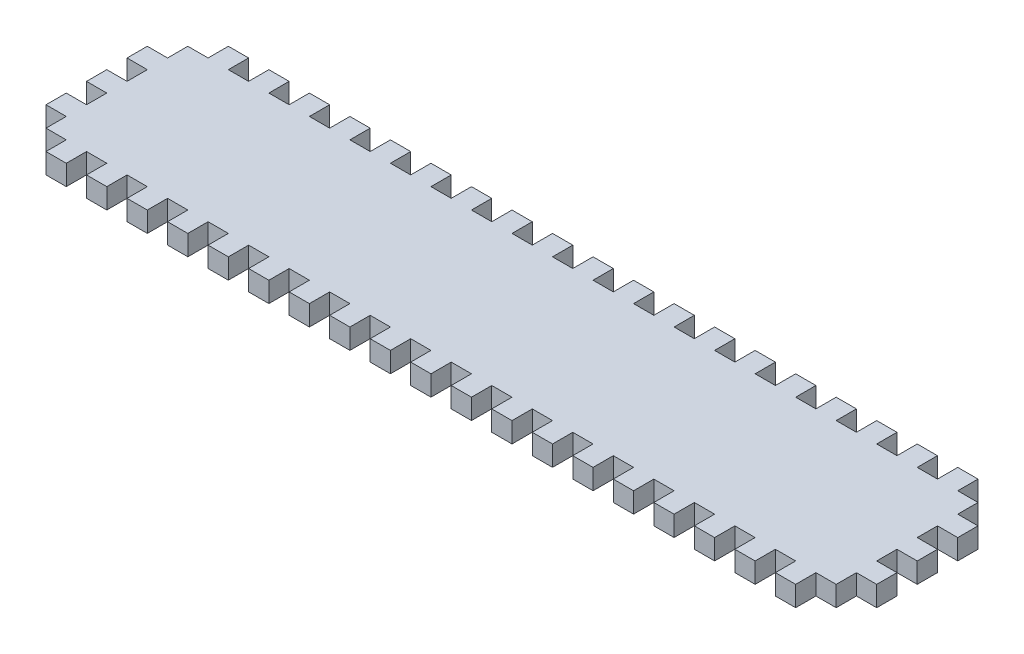
from build123d import *

# Parameters (mm, degrees)
SKETCH1_W               = 260.35
SKETCH1_H               = 57.15
BOSS_EXTRUDE1_DEPTH     = 6.35
SKETCH2_W               = 6.35
SKETCH2_H               = 6.35
CUT_EXTRUDE1_DEPTH      = 6.35
LPATTERN1_COUNT         = 4
LPATTERN1_PITCH         = 12.7
MIRROR1_COPY_1_SKETCH_W = 6.35
MIRROR1_COPY_1_SKETCH_H = 6.35
MIRROR1_COPY_1_DEPTH    = 6.35
MIRROR1_COPY_2_SKETCH_W = 6.35
MIRROR1_COPY_2_SKETCH_H = 6.35
MIRROR1_COPY_2_DEPTH    = 6.35
MIRROR1_COPY_3_SKETCH_W = 6.35
MIRROR1_COPY_3_SKETCH_H = 6.35
MIRROR1_COPY_3_DEPTH    = 6.35
SKETCH3_W               = 6.35
SKETCH3_H               = 6.35
CUT_EXTRUDE3_DEPTH      = 134.425573823
LPATTERN3_START         = -28.575
LPATTERN3_OUTLINE_W     = 6.35
LPATTERN3_OUTLINE_H     = 6.35
LPATTERN3_OUTLINE_W_2   = 12.7
LPATTERN3_DEPTH         = 6.35


# Read off the part's stored shape, not the designer's step: LPattern3, Mirror2
with BuildPart() as part:
    # Sketch1 → Boss-Extrude1 (new body)
    with BuildSketch(Plane(origin=(0, 0, 0), x_dir=(1, 0, 0), z_dir=(0, 1, 0))):
        Rectangle(SKETCH1_W, SKETCH1_H)
    extrude(amount=BOSS_EXTRUDE1_DEPTH)

    # Sketch2 → Cut-Extrude1 (cut)
    with BuildSketch(Plane(origin=(0, 6.35, 0), x_dir=(1, 0, 0), z_dir=(0, 1, 0))):
        with Locations((127, 19.05)):
            Rectangle(SKETCH2_W, SKETCH2_H)
    cut_extrude1 = extrude(amount=-CUT_EXTRUDE1_DEPTH, mode=Mode.SUBTRACT)

    # LPattern1: Cut-Extrude1 ×4
    with Locations(*[(0, 0, i * LPATTERN1_PITCH) for i in range(1, LPATTERN1_COUNT)]):
        add(cut_extrude1, mode=Mode.SUBTRACT)

    # Mirror1: Cut-Extrude1 across plane
    add(cut_extrude1.mirror(Plane(origin=(0, 0, 0), x_dir=(0, 0, 1), z_dir=(1, 0, 0))), mode=Mode.SUBTRACT)

    # Mirror1 copy 1 sketch → Mirror1 copy 1 (cut)
    with BuildSketch(Plane(origin=(0, 6.35, 12.7), x_dir=(-1, 0, 0), z_dir=(0, 1, 0))):
        with Locations((127, -19.05)):
            Rectangle(MIRROR1_COPY_1_SKETCH_W, MIRROR1_COPY_1_SKETCH_H)
    extrude(amount=-MIRROR1_COPY_1_DEPTH, mode=Mode.SUBTRACT)

    # Mirror1 copy 2 sketch → Mirror1 copy 2 (cut)
    with BuildSketch(Plane(origin=(0, 6.35, 25.4), x_dir=(-1, 0, 0), z_dir=(0, 1, 0))):
        with Locations((127, -19.05)):
            Rectangle(MIRROR1_COPY_2_SKETCH_W, MIRROR1_COPY_2_SKETCH_H)
    extrude(amount=-MIRROR1_COPY_2_DEPTH, mode=Mode.SUBTRACT)

    # Mirror1 copy 3 sketch → Mirror1 copy 3 (cut)
    with BuildSketch(Plane(origin=(0, 6.35, 38.1), x_dir=(-1, 0, 0), z_dir=(0, 1, 0))):
        with Locations((127, -19.05)):
            Rectangle(MIRROR1_COPY_3_SKETCH_W, MIRROR1_COPY_3_SKETCH_H)
    extrude(amount=-MIRROR1_COPY_3_DEPTH, mode=Mode.SUBTRACT)

    # Sketch3 → Cut-Extrude3 (cut, through all)
    with BuildSketch(Plane(origin=(0, 6.35, 0), x_dir=(1, 0, 0), z_dir=(0, 1, 0))):
        with Locations((120.65, 25.4)):
            Rectangle(SKETCH3_W, SKETCH3_H)
    extrude(amount=-CUT_EXTRUDE3_DEPTH, mode=Mode.SUBTRACT)


with BuildPart() as body_2:
    # of the pieces the cut leaves, the one that is kept (cut_extrude3_keep)
    add(part.part.solids().sort_by_distance((-130.175, 0, 28.575))[0])

    # LPattern3 outline → LPattern3 (cut)
    with BuildSketch(Plane.XY.offset(LPATTERN3_START)):
        with Locations((107.95, 3.175)):
            Rectangle(LPATTERN3_OUTLINE_W, LPATTERN3_OUTLINE_H)
        with Locations((95.25, 3.175)):
            Rectangle(LPATTERN3_OUTLINE_W, LPATTERN3_OUTLINE_H)
        with Locations((82.55, 3.175)):
            Rectangle(LPATTERN3_OUTLINE_W, LPATTERN3_OUTLINE_H)
        with Locations((69.85, 3.175)):
            Rectangle(LPATTERN3_OUTLINE_W, LPATTERN3_OUTLINE_H)
        with Locations((57.15, 3.175)):
            Rectangle(LPATTERN3_OUTLINE_W, LPATTERN3_OUTLINE_H)
        with Locations((44.45, 3.175)):
            Rectangle(LPATTERN3_OUTLINE_W, LPATTERN3_OUTLINE_H)
        with Locations((31.75, 3.175)):
            Rectangle(LPATTERN3_OUTLINE_W, LPATTERN3_OUTLINE_H)
        with Locations((19.05, 3.175)):
            Rectangle(LPATTERN3_OUTLINE_W, LPATTERN3_OUTLINE_H)
        with Locations((6.35, 3.175)):
            Rectangle(LPATTERN3_OUTLINE_W, LPATTERN3_OUTLINE_H)
        with Locations((-6.35, 3.175)):
            Rectangle(LPATTERN3_OUTLINE_W, LPATTERN3_OUTLINE_H)
        with Locations((-19.05, 3.175)):
            Rectangle(LPATTERN3_OUTLINE_W, LPATTERN3_OUTLINE_H)
        with Locations((-31.75, 3.175)):
            Rectangle(LPATTERN3_OUTLINE_W, LPATTERN3_OUTLINE_H)
        with Locations((-44.45, 3.175)):
            Rectangle(LPATTERN3_OUTLINE_W, LPATTERN3_OUTLINE_H)
        with Locations((-57.15, 3.175)):
            Rectangle(LPATTERN3_OUTLINE_W, LPATTERN3_OUTLINE_H)
        with Locations((-69.85, 3.175)):
            Rectangle(LPATTERN3_OUTLINE_W, LPATTERN3_OUTLINE_H)
        with Locations((-82.55, 3.175)):
            Rectangle(LPATTERN3_OUTLINE_W, LPATTERN3_OUTLINE_H)
        with Locations((-95.25, 3.175)):
            Rectangle(LPATTERN3_OUTLINE_W, LPATTERN3_OUTLINE_H)
        with Locations((-107.95, 3.175)):
            Rectangle(LPATTERN3_OUTLINE_W, LPATTERN3_OUTLINE_H)
        with Locations((-123.825, 3.175)):
            Rectangle(LPATTERN3_OUTLINE_W_2, LPATTERN3_OUTLINE_H)
    extrude(amount=LPATTERN3_DEPTH, mode=Mode.SUBTRACT)

    # Mirror2
    split(bisect_by=Plane.XY, keep=Keep.BOTTOM)

    # Mirror2 2: body 2 across plane


with BuildPart() as body_2_1:
    add(body_2.part)
    add(body_2.part.mirror(Plane.XY))


solid = body_2_1.part
